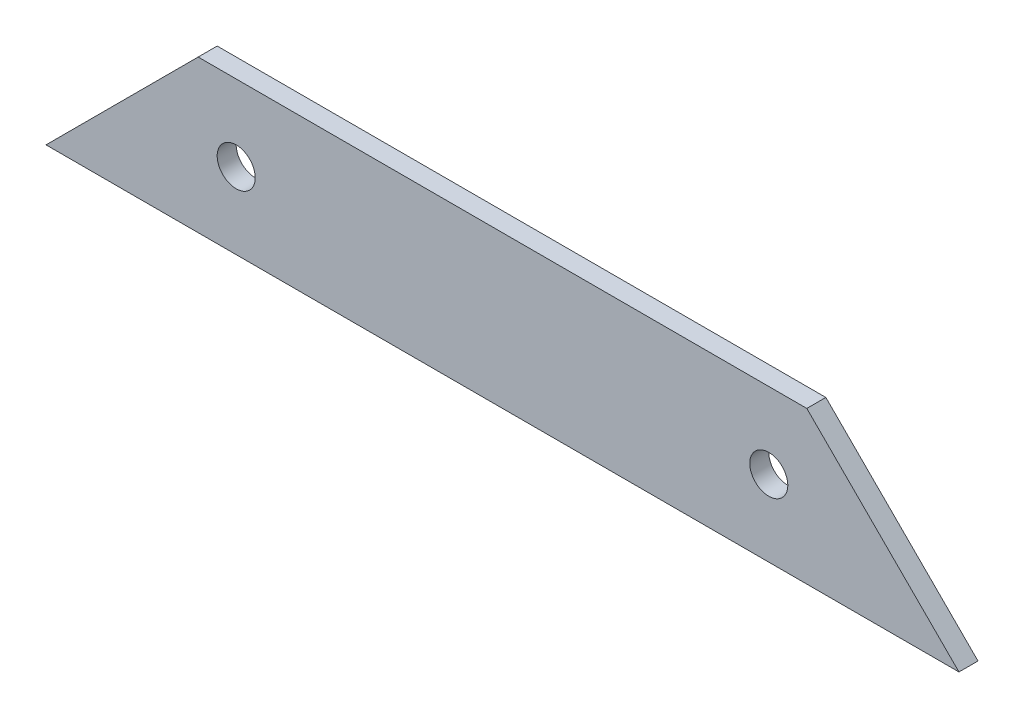
from build123d import *

# Parameters (mm, degrees)
SKETCH3_R           = 3.175
BOSS_EXTRUDE1_DEPTH = 3.175


with BuildPart() as part:
    # Sketch3 → Boss-Extrude1 (new body)
    with BuildSketch(Plane.XY):
        Polygon((50.8, 0), (-50.8, 0), (-76.2, -25.4), (76.2, -25.4), align=None)
        with Locations((-44.45, -12.7)):
            Circle(SKETCH3_R, mode=Mode.SUBTRACT)
        with Locations((44.45, -12.7)):
            Circle(SKETCH3_R, mode=Mode.SUBTRACT)
    extrude(amount=BOSS_EXTRUDE1_DEPTH)


solid = part.part
